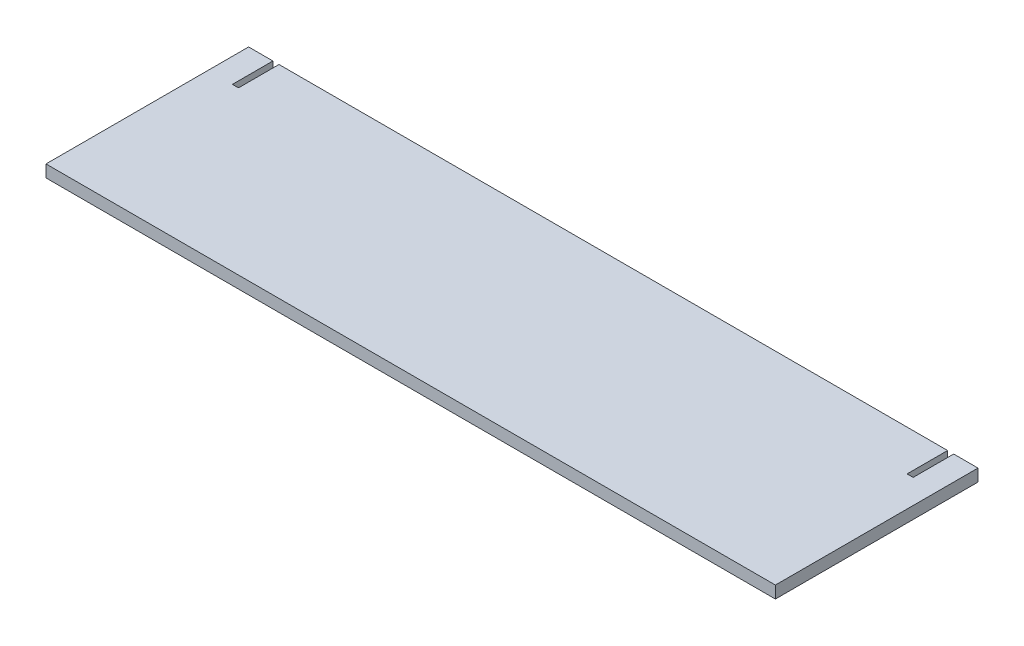
from build123d import *

# Parameters (mm, degrees)
BOSS_EXTRUDE1_DEPTH = 1.5


with BuildPart() as part:
    # Sketch1 → Boss-Extrude1 (new, symmetric)
    with BuildSketch(Plane(origin=(0, 0, 0), x_dir=(1, 0, 0), z_dir=(0, 1, 0))):
        Polygon((-84, 25), (-84, 15), (-82.5, 15), (-82.5, 25), (82.5, 25), (82.5, 15), (84, 15), (84, 25), (90, 25), (90, -25), (-90, -25), (-90, 25), align=None)
    extrude(amount=BOSS_EXTRUDE1_DEPTH, both=True)


solid = part.part
